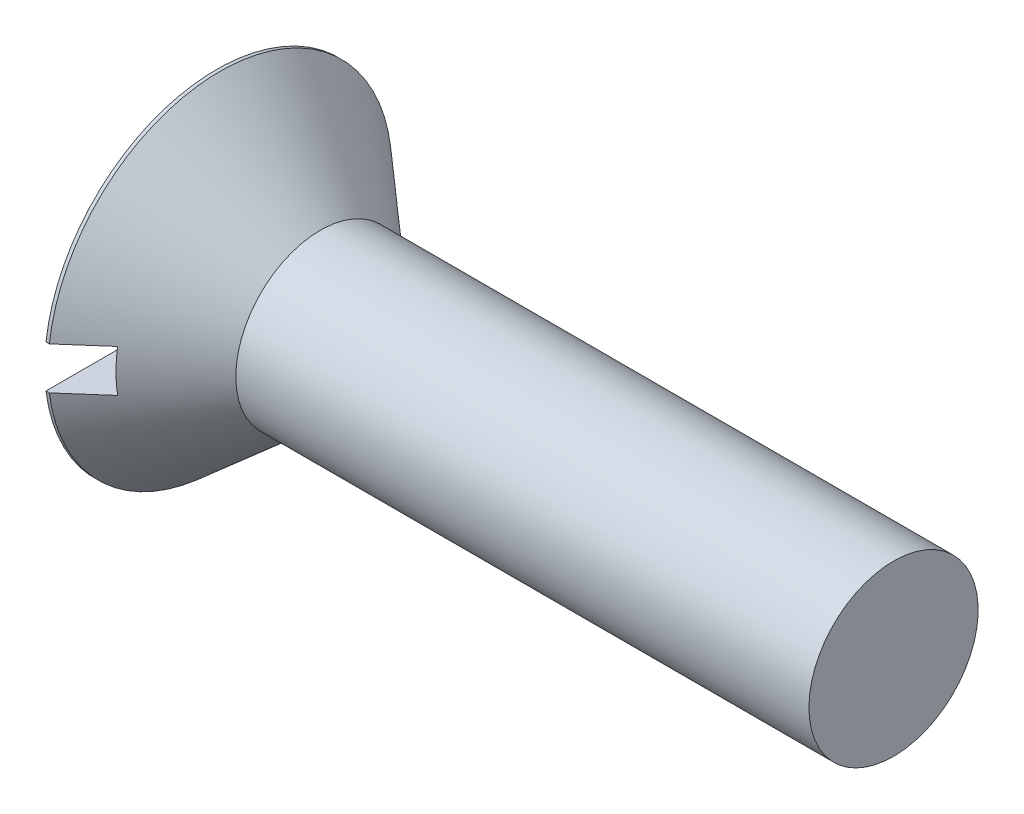
from build123d import *

# Parameters (mm, degrees)
SKETCH2_W         = 19.3548
SKETCH2_H         = 2.3876
SLOT_DEPTH        = 2.2352
CIRPATTERN1_COUNT = 2
CIRPATTERN1_ANGLE = 90


with BuildPart() as part:
    # BodySke → Base-Revolve (revolve)
    with BuildSketch(Plane.XY):
        Polygon((0, 0), (0, 9.6774), (0.188054315, 9.6774), (5.842, 4.7625), (38.1, 4.7625), (38.1, 0), align=None)
    revolve(axis=Axis((-6.35, 0, 0), (1, 0, 0)))

    # Sketch2 → Slot (cut)
    with BuildSketch(Plane.ZY):
        Rectangle(SKETCH2_W, SKETCH2_H)
    extrude(amount=-SLOT_DEPTH, mode=Mode.SUBTRACT)

    # Sketch3 → Cross section 0
    with BuildSketch(Plane.ZY):
        with BuildLine():
            Line((-1.0922, 6.6421), (1.0922, 6.6421))
            Line((1.0922, 6.6421), (1.0922, -6.6421))
            Line((1.0922, -6.6421), (-1.0922, -6.6421))
            Line((-1.0922, -6.6421), (-1.0922, 6.6421))
        make_face()
    # Sketch4 → Cross section 1
    with BuildSketch(Plane.ZY.offset(-7.9756)):
        with BuildLine():
            Line((-0.5461, 0.5461), (0.5461, 0.5461))
            Line((0.5461, 0.5461), (0.5461, -0.5461))
            Line((0.5461, -0.5461), (-0.5461, -0.5461))
            Line((-0.5461, -0.5461), (-0.5461, 0.5461))
        make_face()
    cross = loft(mode=Mode.SUBTRACT)

    # CirPattern1: Cross ×2 about axis
    cirpattern1_axis = Axis((-6.35, 0, 0), (1, 0, 0))
    for i in range(1, CIRPATTERN1_COUNT):
        add(cross.rotate(cirpattern1_axis, i * CIRPATTERN1_ANGLE / (CIRPATTERN1_COUNT - 1)), mode=Mode.SUBTRACT)


solid = part.part
